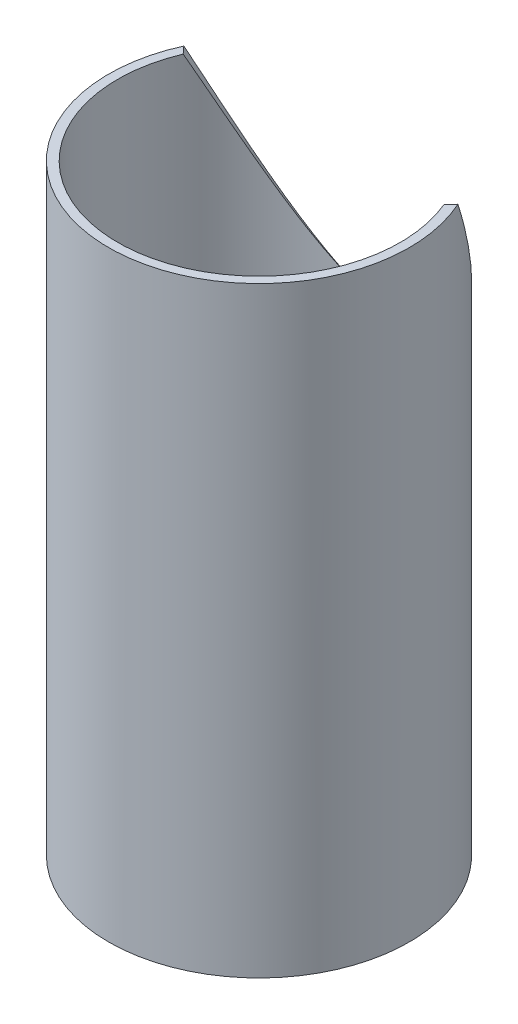
from build123d import *

# Parameters (mm, degrees)
EXTRUDE_1_OUTLINE_R      = 50
EXTRUDE_1_OUTLINE_R_2    = 47
EXTRUDE_1_DEPTH          = 200
CUT_EXTRUDE_1_DEPTH      = 213.132034356
CUT_EXTRUDE_1_DEPTH_BACK = 213.132034356
SKETCH_2_R               = 66.5


# Read off the part's stored shape, not the designer's step: Вытянуть-Тонкостенный1
with BuildPart() as part:
    # Вытянуть-Тонкостенный1 outline → Вытянуть-Тонкостенный1 (new body)
    with BuildSketch(Plane(origin=(0, 0, 0), x_dir=(1, 0, 0), z_dir=(0, 1, 0))):
        Circle(EXTRUDE_1_OUTLINE_R)
        Circle(EXTRUDE_1_OUTLINE_R_2, mode=Mode.SUBTRACT)
    extrude(amount=EXTRUDE_1_DEPTH)

    # Эскиз2 → Вырез-Вытянуть1 (cut, two sides: drawn at the far end of the back side and taken through both)
    with BuildSketch(Plane(origin=(0, 0, 0), x_dir=(1, 0, 0), z_dir=(0, -0.819152044288991, -0.5735764363510473)).offset(-CUT_EXTRUDE_1_DEPTH_BACK)):
        with Locations((0, -180)):
            Circle(SKETCH_2_R)
    extrude(amount=CUT_EXTRUDE_1_DEPTH + CUT_EXTRUDE_1_DEPTH_BACK, mode=Mode.SUBTRACT)


solid = part.part
